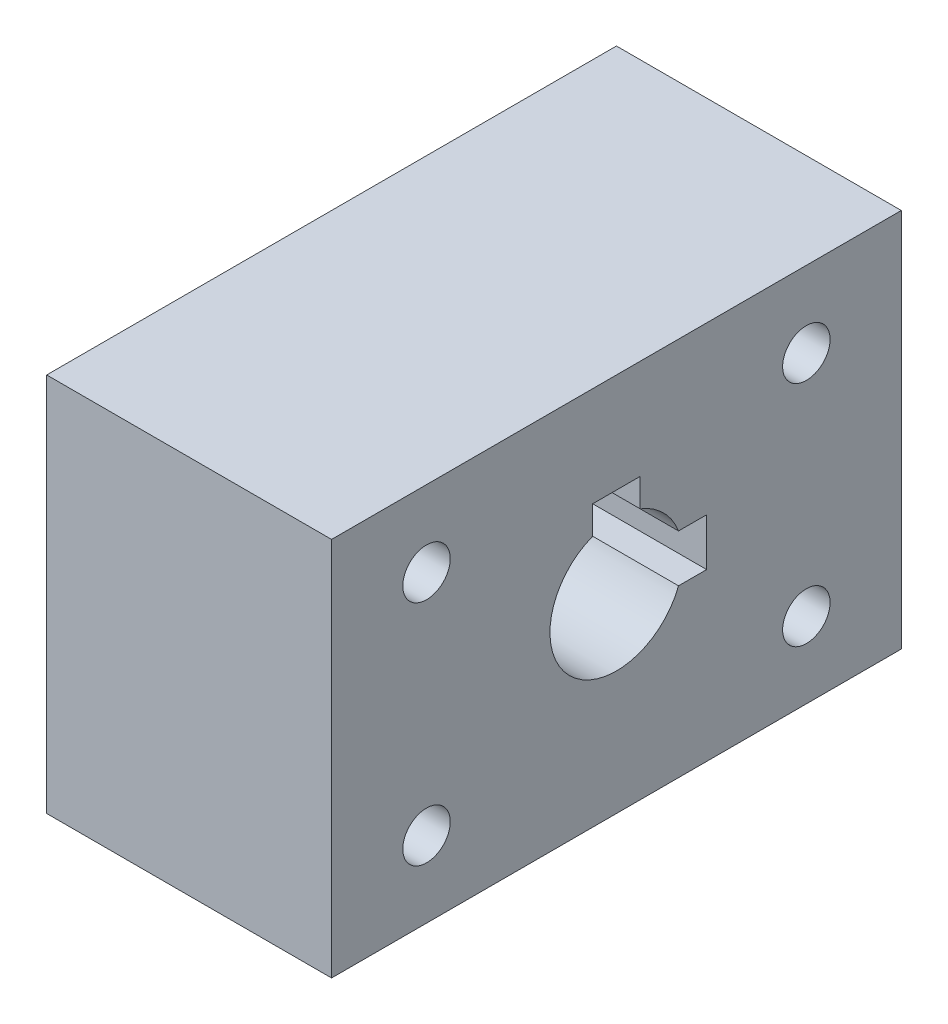
from build123d import *

# Parameters (mm, degrees)
SKETCH1_W                = 60
SKETCH1_H                = 40
BOSS_EXTRUDE1_DEPTH      = 30
CUT_EXTRUDE1_DEPTH       = 47.904157598
F_5_0_5_DIAMETER_HOLE1_D = 5


with BuildPart() as part:
    # Sketch1 → Boss-Extrude1 (new body)
    with BuildSketch(Plane(origin=(0, 0, 0), x_dir=(0, 0, -1), z_dir=(1, 0, 0))):
        Rectangle(SKETCH1_W, SKETCH1_H)
    extrude(amount=BOSS_EXTRUDE1_DEPTH)

    # Sketch2 → Cut-Extrude1 (cut, through all)
    with BuildSketch(Plane(origin=(30, 0, 0), x_dir=(0, 0, -1), z_dir=(1, 0, 0))):
        with BuildLine():
            ThreePointArc((6.538348415, 2.5), (4.949747468, 4.949747468), (2.5, 6.538348415))
            Line((2.5, 6.538348415), (2.5, 9.5))
            Line((2.5, 9.5), (-2.5, 9.5))
            Line((-2.5, 9.5), (-2.5, 6.538348415))
            ThreePointArc((-2.5, 6.538348415), (-4.949747468, -4.949747468), (6.538348415, -2.5))
            Line((6.538348415, -2.5), (9.5, -2.5))
            Line((9.5, -2.5), (9.5, 2.5))
            Line((9.5, 2.5), (6.538348415, 2.5))
        make_face()
    extrude(amount=-CUT_EXTRUDE1_DEPTH, mode=Mode.SUBTRACT)

    # Ø5.0 (5) Diameter Hole1 (through all)
    with Locations(Plane.ZY):
        with Locations((-20, 12), (-20, -12)):
            f_5_0_5_diameter_hole1 = Hole(F_5_0_5_DIAMETER_HOLE1_D / 2)

    # Mirror1: Ø5.0 (5) Diameter Hole1 across plane
    add(f_5_0_5_diameter_hole1.mirror(Plane.XY), mode=Mode.SUBTRACT)


solid = part.part
